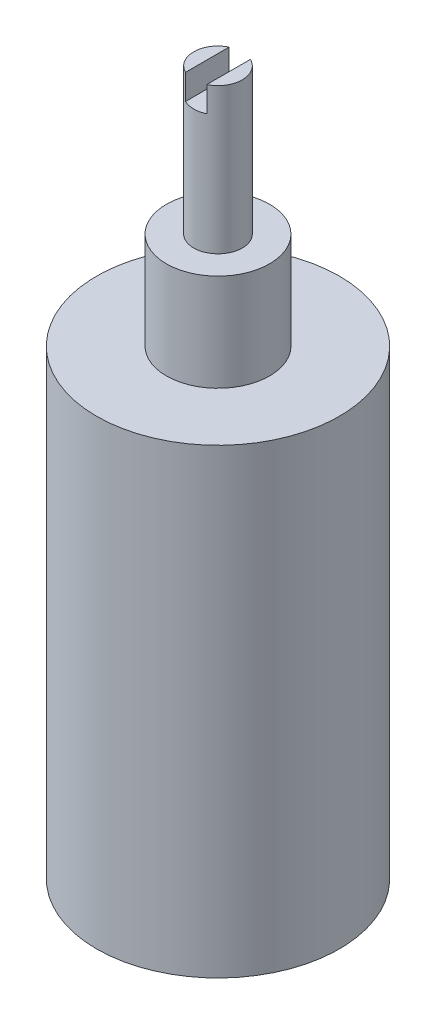
from build123d import *

# Parameters (mm, degrees)
SKETCH1_R               = 10
BOSS_EXTRUDE1_DEPTH     = 19
SKETCH2_R               = 4.25
BOSS_EXTRUDE2_DEPTH     = 8
SKETCH3_R               = 2
BOSS_EXTRUDE3_DEPTH     = 12
CUT_EXTRUDE1_DEPTH      = 42.484937025
CUT_EXTRUDE1_DEPTH_BACK = 42.484937025
SKETCH4_W               = 1.75006174
SKETCH4_H               = 4.164275762


with BuildPart() as part:
    # Sketch1 → Boss-Extrude1 (new, symmetric)
    with BuildSketch(Plane(origin=(0, 0, 0), x_dir=(1, 0, 0), z_dir=(0, 1, 0))):
        Circle(SKETCH1_R)
    extrude(amount=BOSS_EXTRUDE1_DEPTH, both=True)

    # Sketch2 → Boss-Extrude2 (add)
    with BuildSketch(Plane(origin=(0, 19, 0), x_dir=(1, 0, 0), z_dir=(0, 1, 0))):
        Circle(SKETCH2_R)
    extrude(amount=BOSS_EXTRUDE2_DEPTH)

    # Sketch3 → Boss-Extrude3 (add)
    with BuildSketch(Plane(origin=(0, 27, 0), x_dir=(1, 0, 0), z_dir=(0, 1, 0))):
        Circle(SKETCH3_R)
    extrude(amount=BOSS_EXTRUDE3_DEPTH)

    # Sketch4 → Cut-Extrude1 (cut, two sides: drawn at the far end of the back side and taken through both)
    with BuildSketch(Plane.XY.offset(-CUT_EXTRUDE1_DEPTH_BACK)):
        with Locations((0, 39)):
            Rectangle(SKETCH4_W, SKETCH4_H)
    extrude(amount=CUT_EXTRUDE1_DEPTH + CUT_EXTRUDE1_DEPTH_BACK, mode=Mode.SUBTRACT)


solid = part.part
